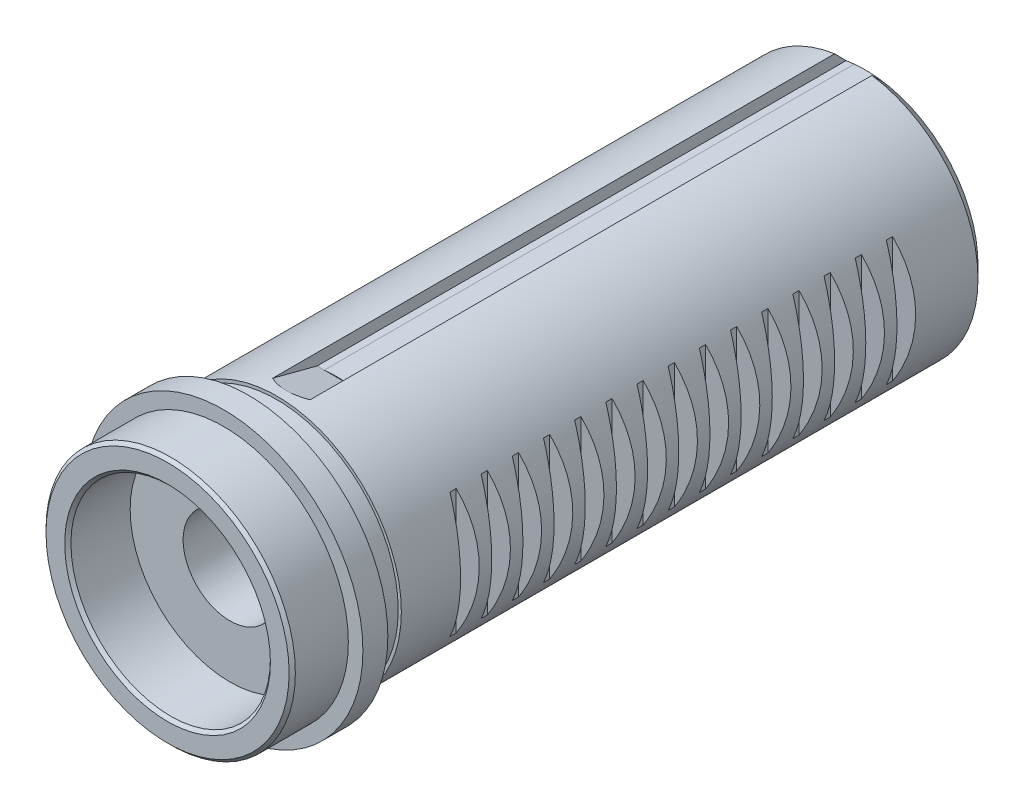
from build123d import *

# Parameters (mm, degrees)
SKETCH1_R           = 22.335
BOSS_EXTRUDE1_DEPTH = 112
CUT_EXTRUDE1_START  = -9
SKETCH2_R           = 22.335
SKETCH2_R_2         = 20
CUT_EXTRUDE1_DEPTH  = 9
SKETCH3_R           = 22.335
SKETCH3_R_2         = 20
CUT_EXTRUDE2_DEPTH  = 99
CUT_EXTRUDE3_START  = 4.5
SKETCH4_R           = 22.335
SKETCH4_R_2         = 19.5
CUT_EXTRUDE3_DEPTH  = 4.5
SKETCH5_R           = 16
CUT_EXTRUDE4_DEPTH  = 10
CHAMFER1_SIZE       = 0.5
SKETCH6_R           = 7.5
CUT_EXTRUDE5_DEPTH  = 107.77876404
CUT_EXTRUDE6_START  = -92.45
SKETCH6_2_R         = 16
SKETCH6_2_R_2       = 7.5
CUT_EXTRUDE6_DEPTH  = 15.32876404
CHAMFER2_SIZE       = 2
CUT_EXTRUDE8_START  = -12
SKETCH8_R           = 16
CUT_EXTRUDE8_DEPTH  = 12
CHAMFER3_SIZE       = 1
CUT_EXTRUDE9_START  = -85
CUT_EXTRUDE9_DEPTH  = 85
CUT_EXTRUDE10_REACH = 118.982
CUT_EXTRUDE11_DEPTH = 117.368829375
LPATTERN1_COUNT     = 15
LPATTERN1_PITCH     = 5


# Read off the part's stored shape, not the designer's step: Cut-Extrude9
with BuildPart() as part:
    # Sketch1 → Boss-Extrude1 (new body)
    with BuildSketch(Plane.XY):
        Circle(SKETCH1_R)
    extrude(amount=BOSS_EXTRUDE1_DEPTH)

    # Sketch2 → Cut-Extrude1 (cut)
    with BuildSketch(Plane.XY.offset(112).offset(CUT_EXTRUDE1_START)):
        Circle(SKETCH2_R)
        Circle(SKETCH2_R_2, mode=Mode.SUBTRACT)
    extrude(amount=CUT_EXTRUDE1_DEPTH, mode=Mode.SUBTRACT)

    # Sketch3 → Cut-Extrude2 (cut)
    with BuildSketch(Plane(origin=(0, 0, 0), x_dir=(-1, 0, 0), z_dir=(0, 0, -1))):
        Circle(SKETCH3_R)
        with Locations(Location((0, 0, 0), (0, 0, 180))):
            Circle(SKETCH3_R_2, mode=Mode.SUBTRACT)
    extrude(amount=-CUT_EXTRUDE2_DEPTH, mode=Mode.SUBTRACT)

    # Sketch4 → Cut-Extrude3 (cut)
    with BuildSketch(Plane(origin=(0, 0, 99), x_dir=(-1, 0, 0), z_dir=(0, 0, -1)).offset(CUT_EXTRUDE3_START)):
        Circle(SKETCH4_R)
        Circle(SKETCH4_R_2, mode=Mode.SUBTRACT)
    extrude(amount=-CUT_EXTRUDE3_DEPTH, mode=Mode.SUBTRACT)

    # Sketch5 → Cut-Extrude4 (cut)
    with BuildSketch(Plane.XY.offset(112)):
        Circle(SKETCH5_R)
    extrude(amount=-CUT_EXTRUDE4_DEPTH, mode=Mode.SUBTRACT)

    # Chamfer1
    chamfer1_edges = [part.edges().sort_by_distance(p)[0] for p in [
        (-16, 0, 112),
        (-20, 0, 112),
    ]]
    chamfer(chamfer1_edges, length=CHAMFER1_SIZE)

    # Sketch6 → Cut-Extrude5 (cut, through all)
    with BuildSketch(Plane.XY.offset(102)):
        Circle(SKETCH6_R)
    extrude(amount=-CUT_EXTRUDE5_DEPTH, mode=Mode.SUBTRACT)

    # Sketch6<2> → Cut-Extrude6 (cut, through all)
    with BuildSketch(Plane.XY.offset(102).offset(CUT_EXTRUDE6_START)):
        Circle(SKETCH6_2_R)
        Circle(SKETCH6_2_R_2, mode=Mode.SUBTRACT)
    extrude(amount=-CUT_EXTRUDE6_DEPTH, mode=Mode.SUBTRACT)

    # Chamfer2
    chamfer2_edges = [part.edges().sort_by_distance(p)[0] for p in [
        (-20, 0, 0),
    ]]
    chamfer(chamfer2_edges, length=CHAMFER2_SIZE)

    # Sketch8 → Cut-Extrude8 (cut)
    with BuildSketch(Plane(origin=(0, 0, 0), x_dir=(-1, 0, 0), z_dir=(0, 0, -1)).offset(CUT_EXTRUDE8_START)):
        with Locations(Location((0, 0, 0), (0, 0, 180))):
            Circle(SKETCH8_R)
    extrude(amount=CUT_EXTRUDE8_DEPTH, mode=Mode.SUBTRACT)

    # Chamfer3
    chamfer3_edges = [part.edges().sort_by_distance(p)[0] for p in [
        (-16, 0, 0),
    ]]
    chamfer(chamfer3_edges, length=CHAMFER3_SIZE)

    # Cut-Extrude9 outline → Cut-Extrude9 (cut)
    with BuildSketch(Plane(origin=(0, 0, 0), x_dir=(-1, 0, 0), z_dir=(0, 0, -1)).offset(CUT_EXTRUDE9_START)):
        with BuildLine():
            Line((3, 17.903719933), (3, 19.773719933))
            ThreePointArc((3, 19.773719933), (0, 20), (-3, 19.773719933))
            Line((-3, 19.773719933), (-3, 17.903719933))
            Line((-3, 17.903719933), (-1.859250535, 17.903719933))
            ThreePointArc((-1.859250535, 17.903719933), (0, 18), (1.859250535, 17.903719933))
            Line((1.859250535, 17.903719933), (3, 17.903719933))
        make_face()
    extrude(amount=CUT_EXTRUDE9_DEPTH, mode=Mode.SUBTRACT)

    # Cut-Extrude10: up to this face of the body (flat: up to its plane)
    cut_extrude10_end = Plane(part.part.faces().sort_by_distance((3, 18.835290902, 43.036448518))[0])
    # Sketch11 → Cut-Extrude10 (cut, up to the picked face)
    with BuildSketch(Plane(origin=(-3, 0, 0), x_dir=(0, 0, -1), z_dir=(1, 0, 0)), mode=Mode.PRIVATE) as cut_extrude10_sk1:
        Polygon((-93, 20), (-85, 20), (-85, 17.903719933), align=None)
    cut_extrude10_tool1 = split(extrude(cut_extrude10_sk1.sketch, amount=CUT_EXTRUDE10_REACH, mode=Mode.PRIVATE), bisect_by=cut_extrude10_end, keep=Keep.BOTH, mode=Mode.PRIVATE)
    add(cut_extrude10_tool1.solids().sort_by(Axis((-3, 19.30124, 87.666667), (1, 0, 0)))[0], mode=Mode.SUBTRACT)

    # Sketch13 → Cut-Extrude11 (cut, symmetric)
    with BuildSketch(Plane(origin=(0, 0, 0), x_dir=(1, 0, 0), z_dir=(0, 1, 0))):
        Polygon((17.3, -83), (17.3, -84), (22.7, -86), (22.7, -81), align=None)
    cut_extrude11 = extrude(amount=CUT_EXTRUDE11_DEPTH, both=True, mode=Mode.SUBTRACT)

    # LPattern1: Cut-Extrude11 ×15
    with Locations(*[(0, 0, -i * LPATTERN1_PITCH) for i in range(1, LPATTERN1_COUNT)]):
        add(cut_extrude11, mode=Mode.SUBTRACT)


solid = part.part
